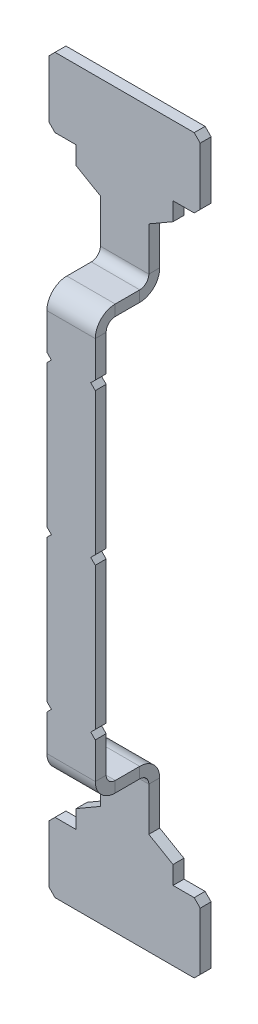
from build123d import *

# Parameters (mm, degrees)
BOSS_EXTRUDE1_DEPTH        = 25.4
SKETCH13_W                 = 4.4958
SKETCH13_H                 = 17.78
CUT_EXTRUDE2_DEPTH         = 41.37401709
CONVERT_SOLID1_DEPTH       = 6.35
CONVERT_SOLID1_2_DEPTH     = 2.032
CONVERT_SOLID1_START       = 2.032
CONVERT_SOLID1_3_OUTLINE_W = 5.842
CONVERT_SOLID1_3_OUTLINE_H = 0.9144
CONVERT_SOLID1_3_DEPTH     = 4.318
CONVERT_SOLID1_START_2     = -0.9144
CONVERT_SOLID1_4_DEPTH     = 0.9144
CHAMFER1_SIZE              = 0.508
CUT_EXTRUDE3_DEPTH         = 32.703524625


with BuildPart() as part:
    # Sketch3 → Boss-Extrude1 (new body)
    with BuildSketch(Plane.XY):
        Polygon((6.35, 24.892), (6.35, 30.734), (0, 30.734), (0, 0), (2.032, 0), (2.032, 22.194824253), (4.064, 23.368), (4.064, 24.892), align=None)
    extrude(amount=BOSS_EXTRUDE1_DEPTH)

    # Sketch13 → Cut-Extrude2 (cut, through all)
    with BuildSketch(Plane(origin=(0, 0, 0), x_dir=(0, 0, -1), z_dir=(1, 0, 0))):
        with Locations((-2.2479, 8.89)):
            Rectangle(SKETCH13_W, SKETCH13_H)
    extrude(amount=CUT_EXTRUDE2_DEPTH, mode=Mode.SUBTRACT)

    # Convert-Solid1: read off the stored shape, not the designer's step
    # Convert-Solid1 outline → Convert-Solid1 (cut)
    with BuildSketch(Plane.YZ):
        with BuildLine():
            Line((30.734, 0), (30.734, 25.4))
            Line((30.734, 25.4), (0, 25.4))
            Line((0, 25.4), (0, 4.4958))
            Line((0, 4.4958), (17.78, 4.4958))
            Line((17.78, 4.4958), (17.78, 0.762))
            ThreePointArc((17.78, 0.762), (18.003184633, 0.223184633), (18.542, 0))
            Line((18.542, 0), (30.734, 0))
        make_face()
    extrude(amount=CONVERT_SOLID1_DEPTH, mode=Mode.SUBTRACT)

    # Convert-Solid1 2 outline → Convert-Solid1 2 (add)
    with BuildSketch(Plane.YZ):
        with BuildLine():
            Line((30.734, -0.9144), (30.734, 0))
            Line((30.734, 0), (17.78, 0))
            Line((17.78, 0), (17.78, 2.8194))
            ThreePointArc((17.78, 2.8194), (17.288993808, 4.004793808), (16.1036, 4.4958))
            Line((16.1036, 4.4958), (0, 4.4958))
            Line((0, 4.4958), (0, 3.5814))
            Line((0, 3.5814), (16.1036, 3.5814))
            ThreePointArc((16.1036, 3.5814), (16.642415367, 3.358215367), (16.8656, 2.8194))
            Line((16.8656, 2.8194), (16.8656, 0.762))
            ThreePointArc((16.8656, 0.762), (17.356606192, -0.423393808), (18.542, -0.9144))
            Line((18.542, -0.9144), (30.734, -0.9144))
        make_face()
    extrude(amount=CONVERT_SOLID1_2_DEPTH)

    # Convert-Solid1 3 outline → Convert-Solid1 3 (add)
    with BuildSketch(Plane.YZ.offset(CONVERT_SOLID1_START)):
        with Locations((27.813, -0.4572)):
            Rectangle(CONVERT_SOLID1_3_OUTLINE_W, CONVERT_SOLID1_3_OUTLINE_H)
    extrude(amount=CONVERT_SOLID1_3_DEPTH)

    # Convert-Solid1 4 outline → Convert-Solid1 4 (add)
    with BuildSketch(Plane.XY.offset(CONVERT_SOLID1_START_2)):
        Polygon((4.064, 23.368), (4.064, 24.892), (2.032, 24.892), (2.032, 22.194824253), align=None)
    extrude(amount=CONVERT_SOLID1_4_DEPTH)

    # Chamfer1
    chamfer1_edges = [part.edges().sort_by_distance(p)[0] for p in [
        (6.35, 24.892, -0.4572),
        (6.35, 30.734, -0.4572),
    ]]
    chamfer(chamfer1_edges, length=CHAMFER1_SIZE)

    # Sketch14 → Cut-Extrude3 (cut, through all)
    with BuildSketch(Plane.XY):
        Polygon((5.08, 16.129), (1.651, 12.7), (5.08, 9.271), align=None)
        Polygon((1.651, 0), (5.08, 3.429), (5.08, -3.429), align=None)
    extrude(amount=CUT_EXTRUDE3_DEPTH, mode=Mode.SUBTRACT)

    # Mirror1: part across plane


with BuildPart() as part_1:
    add(part.part)
    add(part.part.mirror(Plane(origin=(0, 0, 0), x_dir=(0, 0, 1), z_dir=(1, 0, 0))))

    # Mirror2: part across face


with BuildPart() as part_2:
    add(part_1.part)
    add(part_1.part.mirror(Plane(origin=(0, 0, 4.0386), x_dir=(0, 0, 1), z_dir=(0, -1, 0))))


solid = part_2.part
